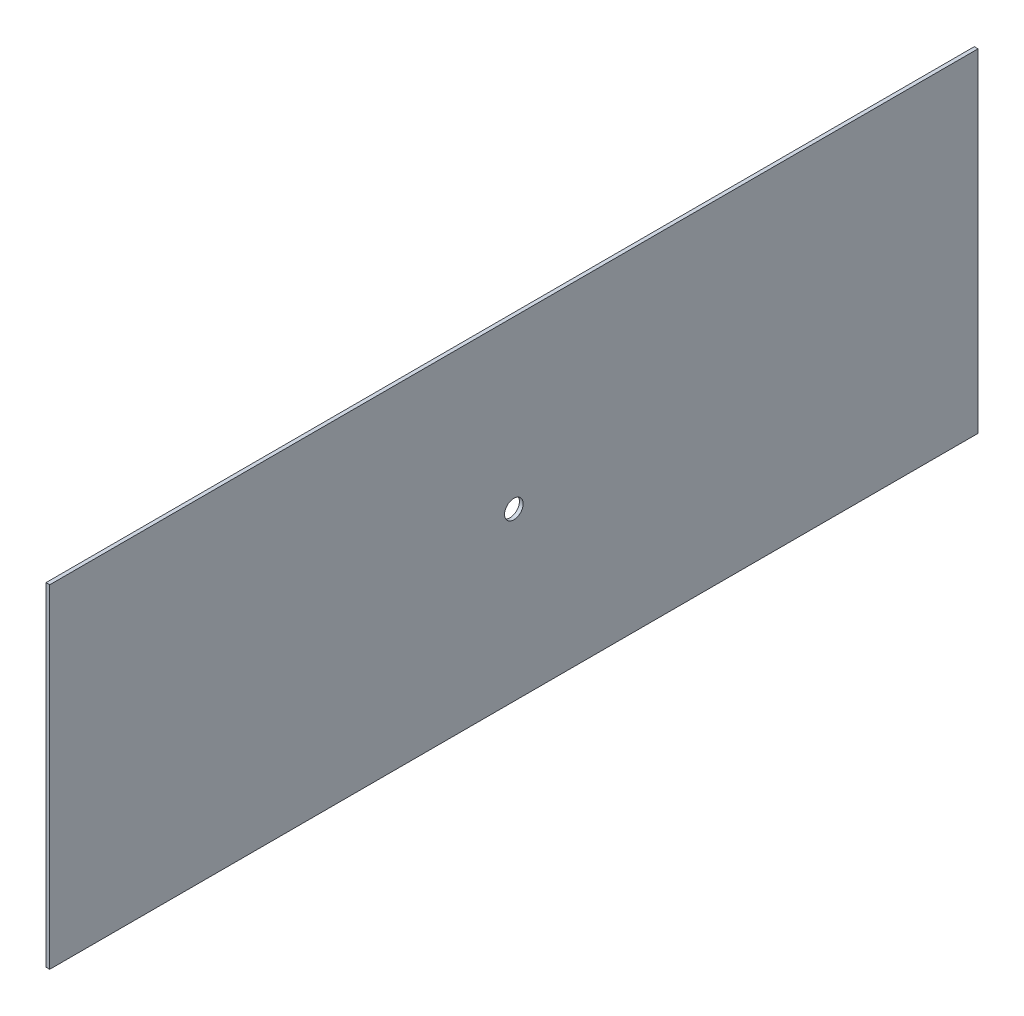
from build123d import *

# Parameters (mm, degrees)
SKETCH1_W           = 249.525
SKETCH1_H           = 89.525
SKETCH1_R           = 2.5
BOSS_EXTRUDE1_DEPTH = 1


with BuildPart() as part:
    # Sketch1 → Boss-Extrude1 (new body)
    with BuildSketch(Plane(origin=(0, 0, 0), x_dir=(0, 0, -1), z_dir=(1, 0, 0))):
        Rectangle(SKETCH1_W, SKETCH1_H)
        Circle(SKETCH1_R, mode=Mode.SUBTRACT)
    extrude(amount=BOSS_EXTRUDE1_DEPTH)


solid = part.part
